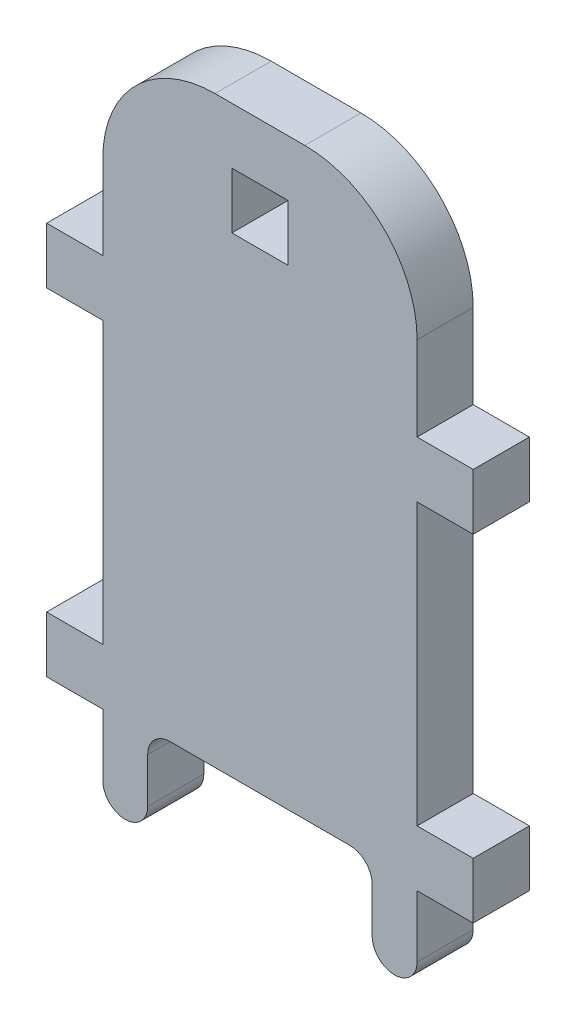
from build123d import *

# Parameters (mm, degrees)
ESQUISSE1_W        = 5
ESQUISSE1_H        = 5
BOSS_EXTRU_1_DEPTH = 5
CONG_1_R           = 2
CONG_2_R           = 2
CONG_3_R           = 10


with BuildPart() as part:
    # Esquisse1 → Boss.-Extru.1 (new body)
    with BuildSketch(Plane.XY):
        Polygon((0, 0), (4, 0), (4, 8), (24, 8), (24, 0), (28, 0), (28, 7.5), (33, 7.5), (33, 12.5), (28, 12.5), (28, 37.5), (33, 37.5), (33, 42.5), (28, 42.5), (28, 60), (0, 60), (0, 42.5), (-5, 42.5), (-5, 37.5), (0, 37.5), (0, 12.5), (-5, 12.5), (-5, 7.5), (0, 7.5), align=None)
        with Locations((14, 52.5)):
            Rectangle(ESQUISSE1_W, ESQUISSE1_H, mode=Mode.SUBTRACT)
    extrude(amount=BOSS_EXTRU_1_DEPTH)

    # Congé1
    cong_1_edges = [part.edges().sort_by_distance(p)[0] for p in [
        (24, 8, 2.5),
        (4, 8, 2.5),
    ]]
    fillet(cong_1_edges, radius=CONG_1_R)

    # Congé2
    cong_2_edges = [part.edges().sort_by_distance(p)[0] for p in [
        (24, 0, 2.5),
        (28, 0, 2.5),
        (0, 0, 2.5),
        (4, 0, 2.5),
    ]]
    fillet(cong_2_edges, radius=CONG_2_R - 0.0001)  # a hair under: the kernel refuses the full size

    # Congé3
    cong_3_edges = [part.edges().sort_by_distance(p)[0] for p in [
        (0, 60, 2.5),
        (28, 60, 2.5),
    ]]
    fillet(cong_3_edges, radius=CONG_3_R)


solid = part.part
